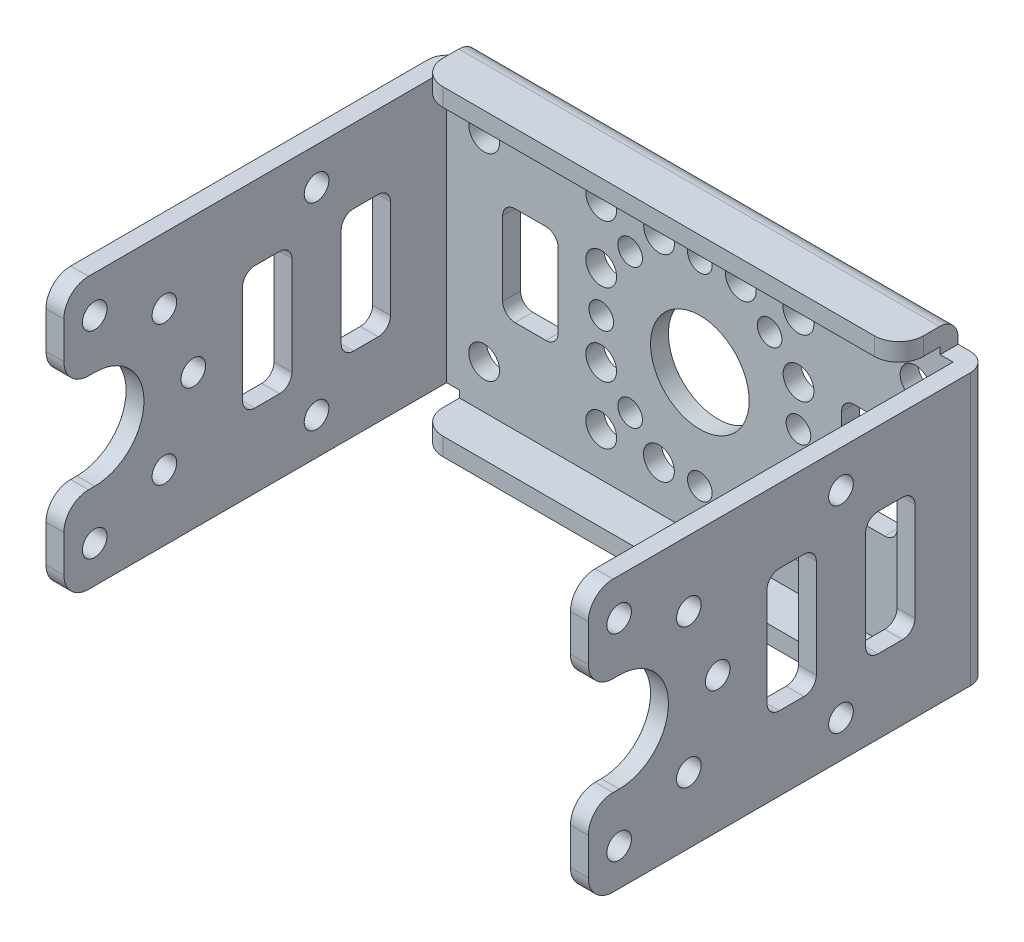
from build123d import *

# Parameters (mm, degrees)
SKETCH1_W              = 44
SKETCH1_H              = 26
BOSS_EXTRUDE1_DEPTH    = 1.45
SKETCH3_R              = 4
CUT_EXTRUDE1_DEPTH     = 52.128294515
SKETCH4_R              = 1
CUT_EXTRUDE2_DEPTH     = 52.128294515
CIRPATTERN1_COUNT      = 8
SKETCH7_R              = 1.25
CUT_EXTRUDE3_DEPTH     = 52.128294515
CIRPATTERN2_COUNT      = 8
SKETCH9_R              = 1.25
CUT_EXTRUDE4_DEPTH     = 52.128294515
CIRPATTERN3_COUNT      = 4
SKETCH10_R             = 1.25
CUT_EXTRUDE5_DEPTH     = 52.128294515
SKETCH11_R             = 1.25
CUT_EXTRUDE6_DEPTH     = 52.128294515
SKETCH14_W             = 4.5
SKETCH14_H             = 8
CUT_EXTRUDE7_DEPTH     = 52.128294515
FILLET1_R              = 1
FILLET1_OF_MIRROR2_R   = 1
SKETCH16_W             = 1.45
SKETCH16_H             = 26
BOSS_EXTRUDE4_DEPTH    = 31.05
SKETCH21_W             = 5
SKETCH21_H             = 8
CUT_EXTRUDE10_DEPTH    = 60.521025697
SKETCH22_R             = 4
CUT_EXTRUDE11_DEPTH    = 60.521025697
SKETCH23_R             = 1
CUT_EXTRUDE12_DEPTH    = 60.521025697
CIRPATTERN5_COUNT      = 8
SKETCH24_W             = 31.05
SKETCH24_H             = 2
CUT_EXTRUDE13_DEPTH    = 60.521025697
SKETCH26_W             = 31.05
SKETCH26_H             = 2
CUT_EXTRUDE14_DEPTH    = 60.521025697
FILLET3_R              = 2
SKETCH28_R             = 1
CUT_EXTRUDE16_DEPTH    = 10
SKETCH30_R             = 1
CUT_EXTRUDE17_DEPTH    = 10
SKETCH31_W             = 4
SKETCH31_H             = 10
CUT_EXTRUDE18_DEPTH    = 3
FILLET4_R              = 1
LPATTERN1_COUNT        = 2
LPATTERN1_PITCH        = 8
FILLET4_OF_LPATTERN1_R = 1
MIRROR3_START          = 42.55
MIRROR3_OUTLINE_R      = 1
MIRROR3_DEPTH          = 1.45
SKETCH34_W             = 39
SKETCH34_H             = 1.45
BOSS_EXTRUDE8_DEPTH    = 3.35
SKETCH37_W             = 2.5
SKETCH37_H             = 2
CUT_EXTRUDE20_DEPTH    = 3.35
SKETCH35_W             = 2.5
SKETCH35_H             = 2
CUT_EXTRUDE21_DEPTH    = 3.35
FILLET5_R              = 1.5
FILLET6_R              = 2
FILLET7_R              = 1.5
FILLET8_R              = 1.5
FILLET9_R              = 2


# Read off the part's stored shape, not the designer's step: Mirror3
with BuildPart() as part:
    # Sketch1 → Boss-Extrude1 (new body)
    with BuildSketch(Plane.XY):
        with Locations((22, 13)):
            Rectangle(SKETCH1_W, SKETCH1_H)
    extrude(amount=BOSS_EXTRUDE1_DEPTH)

    # Sketch3 → Cut-Extrude1 (cut, through all)
    with BuildSketch(Plane.XY.offset(1.45)):
        with Locations((22, 13)):
            Circle(SKETCH3_R)
    extrude(amount=-CUT_EXTRUDE1_DEPTH, mode=Mode.SUBTRACT)

    # Sketch4 → Cut-Extrude2 (cut, through all)
    with BuildSketch(Plane.XY.offset(1.45)):
        with Locations((22, 21)):
            Circle(SKETCH4_R)
    cut_extrude2 = extrude(amount=-CUT_EXTRUDE2_DEPTH, mode=Mode.SUBTRACT)

    # CirPattern1: Cut-Extrude2 ×8 about axis
    cirpattern1_axis = Axis((22, 13, 0), (0, 0, 1))
    for i in range(1, CIRPATTERN1_COUNT):
        add(cut_extrude2.rotate(cirpattern1_axis, i * 360 / CIRPATTERN1_COUNT), mode=Mode.SUBTRACT)

    # Sketch7 → Cut-Extrude3 (cut, through all)
    with BuildSketch(Plane.XY.offset(1.45)):
        with Locations((25.322496408, 21)):
            Circle(SKETCH7_R)
    cut_extrude3 = extrude(amount=-CUT_EXTRUDE3_DEPTH, mode=Mode.SUBTRACT)

    # CirPattern2: Cut-Extrude3 ×8 about axis
    cirpattern2_axis = Axis((22, 13, 0), (0, 0, 1))
    for i in range(1, CIRPATTERN2_COUNT):
        add(cut_extrude3.rotate(cirpattern2_axis, i * 360 / CIRPATTERN2_COUNT), mode=Mode.SUBTRACT)

    # Sketch9 → Cut-Extrude4 (cut, through all)
    with BuildSketch(Plane.XY.offset(1.45)):
        with Locations((30, 21)):
            Circle(SKETCH9_R)
    cut_extrude4 = extrude(amount=-CUT_EXTRUDE4_DEPTH, mode=Mode.SUBTRACT)

    # CirPattern3: Cut-Extrude4 ×4 about axis
    cirpattern3_axis = Axis((22, 13, 0), (0, 0, 1))
    for i in range(1, CIRPATTERN3_COUNT):
        add(cut_extrude4.rotate(cirpattern3_axis, i * 360 / CIRPATTERN3_COUNT), mode=Mode.SUBTRACT)

    # Sketch10 → Cut-Extrude5 (cut, through all)
    with BuildSketch(Plane.XY.offset(1.45)):
        with Locations((39.5, 21)):
            Circle(SKETCH10_R)
    cut_extrude5 = extrude(amount=-CUT_EXTRUDE5_DEPTH, mode=Mode.SUBTRACT)

    # Sketch11 → Cut-Extrude6 (cut, through all)
    with BuildSketch(Plane.XY.offset(1.45)):
        with Locations((39.5, 5)):
            Circle(SKETCH11_R)
    cut_extrude6 = extrude(amount=-CUT_EXTRUDE6_DEPTH, mode=Mode.SUBTRACT)

    # Mirror1: Cut-Extrude5, Cut-Extrude6 across plane
    add(cut_extrude5.mirror(Plane(origin=(22, 0, 0), x_dir=(0, 0, 1), z_dir=(1, 0, 0))), mode=Mode.SUBTRACT)
    add(cut_extrude6.mirror(Plane(origin=(22, 0, 0), x_dir=(0, 0, 1), z_dir=(1, 0, 0))), mode=Mode.SUBTRACT)

    # Sketch14 → Cut-Extrude7 (cut, through all)
    with BuildSketch(Plane.XY.offset(1.45)):
        with Locations((8.25, 13)):
            Rectangle(SKETCH14_W, SKETCH14_H)
    cut_extrude7 = extrude(amount=-CUT_EXTRUDE7_DEPTH, mode=Mode.SUBTRACT)

    # Fillet1
    fillet1_edges = [part.edges().sort_by_distance(p)[0] for p in [
        (10.5, 9, 0.725),
        (6, 9, 0.725),
        (6, 17, 0.725),
        (10.5, 17, 0.725),
    ]]
    fillet(fillet1_edges, radius=FILLET1_R)

    # Mirror2: Cut-Extrude7 across plane
    add(cut_extrude7.mirror(Plane(origin=(22, 0, 0), x_dir=(0, 0, 1), z_dir=(1, 0, 0))), mode=Mode.SUBTRACT)

    # Fillet1 of Mirror2
    fillet1_of_mirror2_edges = [part.edges().sort_by_distance(p)[0] for p in [
        (33.5, 9, 0.725),
        (38, 9, 0.725),
        (38, 17, 0.725),
        (33.5, 17, 0.725),
    ]]
    fillet(fillet1_of_mirror2_edges, radius=FILLET1_OF_MIRROR2_R)

    # Sketch16 → Boss-Extrude4 (add)
    with BuildSketch(Plane.XY.offset(1.45)):
        with Locations((0.725, 13)):
            Rectangle(SKETCH16_W, SKETCH16_H)
    extrude(amount=BOSS_EXTRUDE4_DEPTH)

    # Sketch21 → Cut-Extrude10 (cut, through all)
    with BuildSketch(Plane(origin=(1.45, 0, 0), x_dir=(0, 0, -1), z_dir=(1, 0, 0))):
        with Locations((-32.5, 13)):
            Rectangle(SKETCH21_W, SKETCH21_H)
    extrude(amount=-CUT_EXTRUDE10_DEPTH, mode=Mode.SUBTRACT)

    # Sketch22 → Cut-Extrude11 (cut, through all)
    with BuildSketch(Plane(origin=(1.45, 0, 0), x_dir=(0, 0, -1), z_dir=(1, 0, 0))):
        with Locations((-30, 13)):
            Circle(SKETCH22_R)
    extrude(amount=-CUT_EXTRUDE11_DEPTH, mode=Mode.SUBTRACT)

    # Sketch23 → Cut-Extrude12 (cut, through all)
    with BuildSketch(Plane(origin=(1.45, 0, 0), x_dir=(0, 0, -1), z_dir=(1, 0, 0))):
        with Locations((-22, 13)):
            Circle(SKETCH23_R)
    cut_extrude12 = extrude(amount=-CUT_EXTRUDE12_DEPTH, mode=Mode.SUBTRACT)

    # CirPattern5: Cut-Extrude12 ×8 about axis, 2 skipped
    cirpattern5_axis = Axis((0, 13, 30), (1, 0, 0))
    add([cut_extrude12.rotate(cirpattern5_axis, i * 360 / CIRPATTERN5_COUNT) for i in range(1, CIRPATTERN5_COUNT) if i not in (4, 5)], mode=Mode.SUBTRACT)

    # Sketch24 → Cut-Extrude13 (cut, through all)
    with BuildSketch(Plane(origin=(1.45, 0, 0), x_dir=(0, 0, -1), z_dir=(1, 0, 0))):
        with Locations((-16.975, 25)):
            Rectangle(SKETCH24_W, SKETCH24_H)
    extrude(amount=-CUT_EXTRUDE13_DEPTH, mode=Mode.SUBTRACT)

    # Sketch26 → Cut-Extrude14 (cut, through all)
    with BuildSketch(Plane(origin=(1.45, 0, 0), x_dir=(0, 0, -1), z_dir=(1, 0, 0))):
        with Locations((-16.975, 1)):
            Rectangle(SKETCH26_W, SKETCH26_H)
    extrude(amount=-CUT_EXTRUDE14_DEPTH, mode=Mode.SUBTRACT)

    # Fillet3
    fillet3_edges = [part.edges().sort_by_distance(p)[0] for p in [
        (0.725, 17, 32.5),
        (0.725, 9, 32.5),
        (0.725, 24, 32.5),
        (0.725, 2, 32.5),
    ]]
    fillet(fillet3_edges, radius=FILLET3_R)

    # Sketch28 → Cut-Extrude16 (cut)
    with BuildSketch(Plane.ZY):
        with Locations((12, 21)):
            Circle(SKETCH28_R)
    extrude(amount=-CUT_EXTRUDE16_DEPTH, mode=Mode.SUBTRACT)

    # Sketch30 → Cut-Extrude17 (cut)
    with BuildSketch(Plane.ZY):
        with Locations((12, 5)):
            Circle(SKETCH30_R)
    extrude(amount=-CUT_EXTRUDE17_DEPTH, mode=Mode.SUBTRACT)

    # Sketch31 → Cut-Extrude18 (cut)
    with BuildSketch(Plane.ZY):
        with Locations((16, 13)):
            Rectangle(SKETCH31_W, SKETCH31_H)
    cut_extrude18 = extrude(amount=-CUT_EXTRUDE18_DEPTH, mode=Mode.SUBTRACT)

    # Fillet4
    fillet4_edges = [part.edges().sort_by_distance(p)[0] for p in [
        (0.725, 8, 14),
        (0.725, 18, 14),
        (0.725, 18, 18),
        (0.725, 8, 18),
    ]]
    fillet(fillet4_edges, radius=FILLET4_R)

    # LPattern1: Cut-Extrude18 ×2
    with Locations(*[(0, 0, -i * LPATTERN1_PITCH) for i in range(1, LPATTERN1_COUNT)]):
        add(cut_extrude18, mode=Mode.SUBTRACT)

    # Fillet4 of LPattern1
    fillet4_of_lpattern1_edges = [part.edges().sort_by_distance(p)[0] for p in [
        (0.725, 8, 6),
        (0.725, 18, 6),
        (0.725, 18, 10),
        (0.725, 8, 10),
    ]]
    fillet(fillet4_of_lpattern1_edges, radius=FILLET4_OF_LPATTERN1_R)

    # Mirror3 outline → Mirror3 (add)
    with BuildSketch(Plane.YZ.offset(MIRROR3_START)):
        with BuildLine():
            Line((7, 32.5), (4, 32.5))
            ThreePointArc((4, 32.5), (2.585786438, 31.914213562), (2, 30.5))
            Line((2, 30.5), (2, 1.45))
            Line((2, 1.45), (24, 1.45))
            Line((24, 1.45), (24, 30.5))
            ThreePointArc((24, 30.5), (23.414213562, 31.914213562), (22, 32.5))
            Line((22, 32.5), (19, 32.5))
            ThreePointArc((19, 32.5), (17.585786438, 31.914213562), (17, 30.5))
            Line((17, 30.5), (17, 30))
            ThreePointArc((17, 30), (13, 26), (9, 30))
            Line((9, 30), (9, 30.5))
            ThreePointArc((9, 30.5), (8.414213562, 31.914213562), (7, 32.5))
        make_face()
        with Locations((5, 12)):
            Circle(MIRROR3_OUTLINE_R, mode=Mode.SUBTRACT)
        with BuildLine():
            Line((18, 9), (18, 7))
            ThreePointArc((18, 7), (17.707106781, 6.292893219), (17, 6))
            Line((17, 6), (9, 6))
            ThreePointArc((9, 6), (8.292893219, 6.292893219), (8, 7))
            Line((8, 7), (8, 9))
            ThreePointArc((8, 9), (8.292893219, 9.707106781), (9, 10))
            Line((9, 10), (17, 10))
            ThreePointArc((17, 10), (17.707106781, 9.707106781), (18, 9))
        make_face(mode=Mode.SUBTRACT)
        with BuildLine():
            ThreePointArc((18, 15), (17.707106781, 14.292893219), (17, 14))
            Line((17, 14), (9, 14))
            ThreePointArc((9, 14), (8.292893219, 14.292893219), (8, 15))
            Line((8, 15), (8, 17))
            ThreePointArc((8, 17), (8.292893219, 17.707106781), (9, 18))
            Line((9, 18), (17, 18))
            ThreePointArc((17, 18), (17.707106781, 17.707106781), (18, 17))
            Line((18, 17), (18, 15))
        make_face(mode=Mode.SUBTRACT)
        with Locations((21, 12)):
            Circle(MIRROR3_OUTLINE_R, mode=Mode.SUBTRACT)
        with Locations((7.343145751, 24.343145751)):
            Circle(MIRROR3_OUTLINE_R, mode=Mode.SUBTRACT)
        with Locations((5, 30)):
            Circle(MIRROR3_OUTLINE_R, mode=Mode.SUBTRACT)
        with Locations((13, 22)):
            Circle(MIRROR3_OUTLINE_R, mode=Mode.SUBTRACT)
        with Locations((18.656854249, 24.343145751)):
            Circle(MIRROR3_OUTLINE_R, mode=Mode.SUBTRACT)
        with Locations((21, 30)):
            Circle(MIRROR3_OUTLINE_R, mode=Mode.SUBTRACT)
    extrude(amount=MIRROR3_DEPTH)

    # Sketch34 → Boss-Extrude8 (add)
    with BuildSketch(Plane.XY.offset(1.45)):
        with Locations((22, 25.275)):
            Rectangle(SKETCH34_W, SKETCH34_H)
    boss_extrude8 = extrude(amount=BOSS_EXTRUDE8_DEPTH)

    # Sketch37 → Cut-Extrude20 (cut)
    with BuildSketch(Plane.XY.offset(1.45)):
        with Locations((42.75, 25)):
            Rectangle(SKETCH37_W, SKETCH37_H)
    cut_extrude20 = extrude(amount=-CUT_EXTRUDE20_DEPTH, mode=Mode.SUBTRACT)

    # Sketch35 → Cut-Extrude21 (cut)
    with BuildSketch(Plane.XY.offset(1.45)):
        with Locations((1.25, 25)):
            Rectangle(SKETCH35_W, SKETCH35_H)
    cut_extrude21 = extrude(amount=-CUT_EXTRUDE21_DEPTH, mode=Mode.SUBTRACT)

    # Fillet5
    fillet5_edges = [part.edges().sort_by_distance(p)[0] for p in [
        (22, 26, 0),
    ]]
    fillet(fillet5_edges, radius=FILLET5_R)

    # Fillet6
    fillet6_edges = [part.edges().sort_by_distance(p)[0] for p in [
        (2.5, 25.275, 4.8),
        (41.5, 25.275, 4.8),
    ]]
    fillet(fillet6_edges, radius=FILLET6_R)

    # Fillet7
    fillet7_edges = [part.edges().sort_by_distance(p)[0] for p in [
        (44, 12, 0),
        (0, 12, 0),
    ]]
    fillet(fillet7_edges, radius=FILLET7_R)

    # Mirror5: Boss-Extrude8, Cut-Extrude20, Cut-Extrude21 across plane
    add(boss_extrude8.mirror(Plane.ZX.offset(13)))
    add(cut_extrude20.mirror(Plane.ZX.offset(13)), mode=Mode.SUBTRACT)
    add(cut_extrude21.mirror(Plane.ZX.offset(13)), mode=Mode.SUBTRACT)

    # Fillet8
    fillet8_edges = [part.edges().sort_by_distance(p)[0] for p in [
        (22, 0, 0),
    ]]
    fillet(fillet8_edges, radius=FILLET8_R)

    # Fillet9
    fillet9_edges = [part.edges().sort_by_distance(p)[0] for p in [
        (2.5, 0.725, 4.8),
        (41.5, 0.725, 4.8),
    ]]
    fillet(fillet9_edges, radius=FILLET9_R)


solid = part.part
